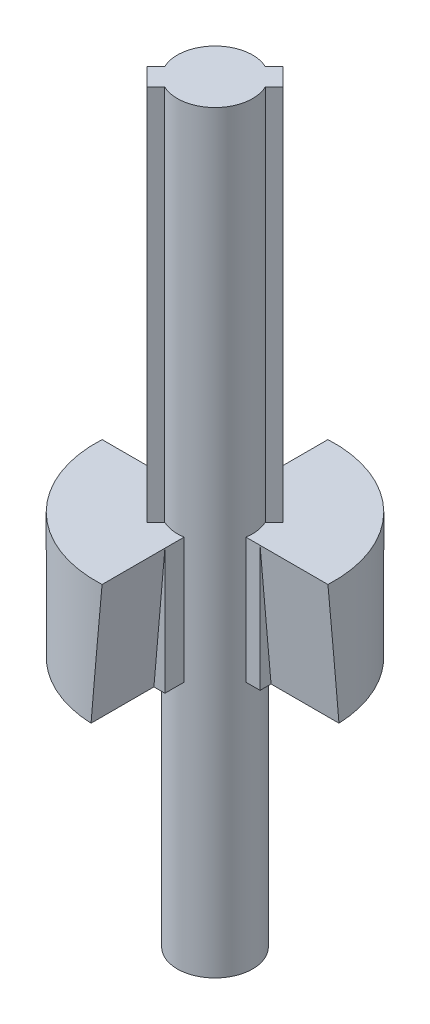
from build123d import *

# Parameters (mm, degrees)
BOSS_EXTRUDE1_DEPTH = 15
SKETCH2_R           = 4.75
SKETCH2_R_2         = 1.5
CUT_EXTRUDE1_DEPTH  = 15
CUT_EXTRUDE2_START  = 10
SKETCH3_R           = 4.75
SKETCH3_R_2         = 1.5
CUT_EXTRUDE2_DEPTH  = 10
BOSS_EXTRUDE2_REACH = 34.871
CUT_EXTRUDE4_START  = -2.5
CUT_EXTRUDE4_DEPTH  = 2.75
CIRPATTERN1_COUNT   = 2
CUT_EXTRUDE5_START  = -2.5
CUT_EXTRUDE5_DEPTH  = 5.2
CIRPATTERN2_COUNT   = 2


with BuildPart() as part:
    # Sketch1 → Boss-Extrude1 (new, symmetric)
    with BuildSketch(Plane(origin=(0, 0, 0), x_dir=(1, 0, 0), z_dir=(0, 1, 0))):
        with BuildLine():
            Line((0.00658351, 5), (3.270980054, 5))
            ThreePointArc((3.270980054, 5), (3.689339828, 5.810660172), (4.5, 6.229019946))
            Line((4.5, 6.229019946), (4.5, 9.49341649))
            ThreePointArc((4.5, 9.49341649), (8.108757211, 8.108757211), (9.49341649, 4.5))
            Line((9.49341649, 4.5), (6.229019946, 4.5))
            ThreePointArc((6.229019946, 4.5), (5.810660172, 3.689339828), (5, 3.270980054))
            Line((5, 3.270980054), (5, 0.00658351))
            ThreePointArc((5, 0.00658351), (1.391242789, 1.391242789), (0.00658351, 5))
        make_face()
    extrude(amount=BOSS_EXTRUDE1_DEPTH, both=True)

    # Sketch2 → Cut-Extrude1 (cut)
    with BuildSketch(Plane(origin=(0, 15, 0), x_dir=(1, 0, 0), z_dir=(0, 1, 0))):
        with Locations((4.75, 4.75)):
            Circle(SKETCH2_R)
        with Locations((4.75, 4.75)):
            Circle(SKETCH2_R_2, mode=Mode.SUBTRACT)
    extrude(amount=-CUT_EXTRUDE1_DEPTH, mode=Mode.SUBTRACT)

    # Sketch3 → Cut-Extrude2 (cut)
    with BuildSketch(Plane(origin=(0, -15, -15), x_dir=(1, 0, 0), z_dir=(0, 1, 0)).offset(CUT_EXTRUDE2_START)):
        with Locations((4.75, -10.25)):
            Circle(SKETCH3_R)
        with Locations((4.75, -10.25)):
            Circle(SKETCH3_R_2, mode=Mode.SUBTRACT)
    extrude(amount=-CUT_EXTRUDE2_DEPTH, mode=Mode.SUBTRACT)

    # Sketch4 → Boss-Extrude2 (add, up to next)
    with BuildSketch(Plane(origin=(0, 15, 0), x_dir=(1, 0, 0), z_dir=(0, 1, 0)), mode=Mode.PRIVATE) as boss_extrude2_sk1:
        with BuildLine():
            Line((4.103553391, 3.396446609), (3.75, 3.042893219))
            Line((3.75, 3.042893219), (3.042893219, 3.75))
            Line((3.042893219, 3.75), (3.396446609, 4.103553391))
            ThreePointArc((3.396446609, 4.103553391), (3.689339828, 3.689339828), (4.103553391, 3.396446609))
        make_face()
    boss_extrude2_tool1 = extrude(boss_extrude2_sk1.sketch, amount=-BOSS_EXTRUDE2_REACH, mode=Mode.PRIVATE) - part.part
    # Sketch4 → Boss-Extrude2 (add, up to next)
    with BuildSketch(Plane(origin=(0, 15, 0), x_dir=(1, 0, 0), z_dir=(0, 1, 0)), mode=Mode.PRIVATE) as boss_extrude2_sk2:
        with BuildLine():
            Line((5.75, 6.457106781), (5.396446609, 6.103553391))
            ThreePointArc((5.396446609, 6.103553391), (5.810660172, 5.810660172), (6.103553391, 5.396446609))
            Line((6.103553391, 5.396446609), (6.457106781, 5.75))
            Line((6.457106781, 5.75), (5.75, 6.457106781))
        make_face()
    boss_extrude2_tool2 = extrude(boss_extrude2_sk2.sketch, amount=-BOSS_EXTRUDE2_REACH, mode=Mode.PRIVATE) - part.part
    add(boss_extrude2_tool1.solids().sort_by_distance((3.553403, 15, -3.553403))[0])
    add(boss_extrude2_tool2.solids().sort_by_distance((5.946597, 15, -5.946597))[0])

    # Sketch5 → Cut-Extrude4 (cut)
    with BuildSketch(Plane.XY.offset(-0.00658351).offset(CUT_EXTRUDE4_START)):
        Polygon((5, 0), (4.562556682, -5), (5, -5), align=None)
    cut_extrude4 = extrude(amount=CUT_EXTRUDE4_DEPTH, mode=Mode.SUBTRACT)

    # CirPattern1: Cut-Extrude4 ×2 about axis
    cirpattern1_axis = Axis((4.75, 15, -4.75), (0, -1, 0))
    for i in range(1, CIRPATTERN1_COUNT):
        add(cut_extrude4.rotate(cirpattern1_axis, i * 360 / CIRPATTERN1_COUNT), mode=Mode.SUBTRACT)

    # Sketch10 → Cut-Extrude5 (cut)
    with BuildSketch(Plane(origin=(0.00658351, 0, 0), x_dir=(0, 0, -1), z_dir=(1, 0, 0)).offset(CUT_EXTRUDE5_START)):
        Polygon((5, -5), (5, 0), (4.562556682, -5), align=None)
    cut_extrude5 = extrude(amount=CUT_EXTRUDE5_DEPTH, mode=Mode.SUBTRACT)

    # CirPattern2: Cut-Extrude5 ×2 about axis
    cirpattern2_axis = Axis((4.75, 15, -4.75), (0, -1, 0))
    for i in range(1, CIRPATTERN2_COUNT):
        add(cut_extrude5.rotate(cirpattern2_axis, i * 360 / CIRPATTERN2_COUNT), mode=Mode.SUBTRACT)


solid = part.part
